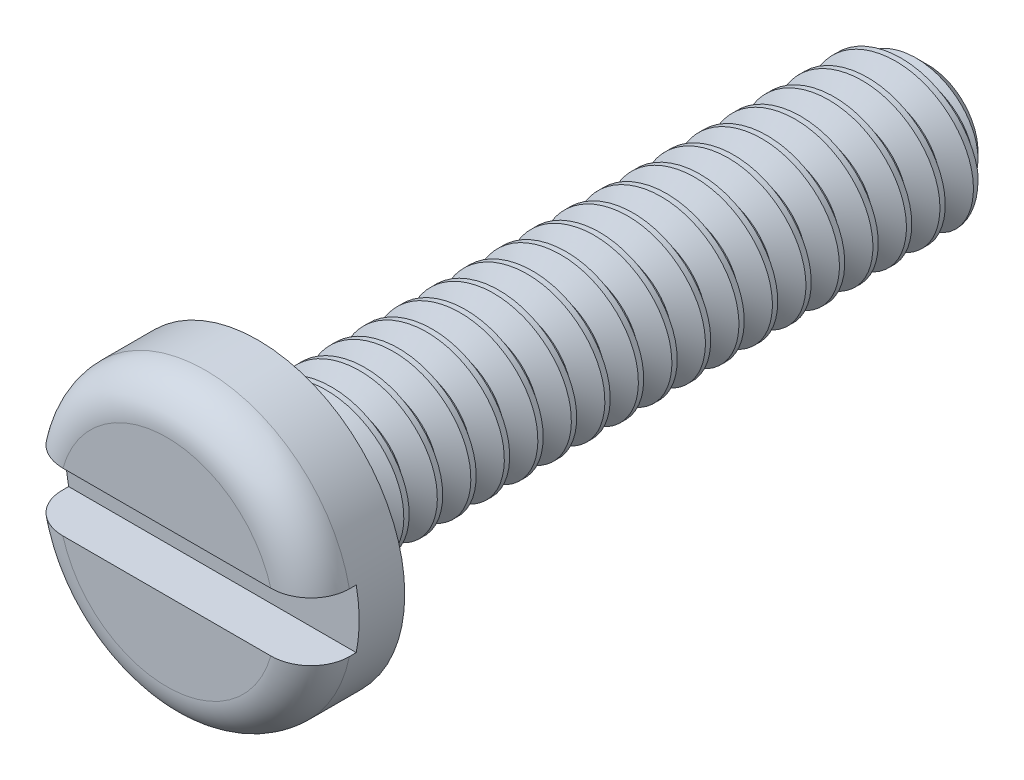
from build123d import *

# Parameters (mm, degrees)
SKETCH1_R        = 2.7813
EXTRUDE3_DEPTH   = 1.7272
SKETCH4_W        = 12.7
SKETCH4_H        = 1.4224
CHAMFER2_SIZE    = 0.47625
CUT_SWEEP1_PITCH = 0.635
CUT_SWEEP1_TO    = 12.7
SKETCH26_R       = 0.5461
EXTRUDE13_DEPTH  = 1.7272
SKETCH31_W       = 5.5626
SKETCH31_H       = 1.11125
EXTRUDE15_DEPTH  = 0.8636


with BuildPart() as part:
    # Sketch1 → Extrude3 (new body)
    with BuildSketch(Plane.XY):
        Circle(SKETCH1_R)
    extrude(amount=EXTRUDE3_DEPTH)

    # Sketch11 → Cut-Revolve3 (revolve, cut)
    with BuildSketch(Plane(origin=(0, 0, 0), x_dir=(0, 0, -1), z_dir=(1, 0, 0))):
        with BuildLine():
            Line((-1.7272, 2.04724), (-1.7272, 0))
            Line((-1.7272, 0), (-1.9812, 0))
            Line((-1.9812, 0), (-1.9812, 2.892552))
            Line((-1.9812, 2.892552), (0, 2.892552))
            Line((0, 2.892552), (0, 2.7813))
            Line((0, 2.7813), (-0.99314, 2.7813))
            ThreePointArc((-0.99314, 2.7813), (-1.512198804, 2.566298804), (-1.7272, 2.04724))
        make_face()
    revolve(axis=Axis((0, 0, 0), (0, 0, 1)), mode=Mode.SUBTRACT)



with BuildPart() as body_2:
    # Sketch4 → Revolve1 (revolve)
    with BuildSketch(Plane(origin=(0, 0, 0), x_dir=(0, 0, -1), z_dir=(1, 0, 0))):
        with Locations((6.35, 0.7112)):
            Rectangle(SKETCH4_W, SKETCH4_H)
    revolve(axis=Axis((0, 0, 0), (0, 0, -1)))

    # Chamfer2
    chamfer2_edges = [body_2.edges().sort_by_distance(p)[0] for p in [
        (0, -1.4224, -12.7),
    ]]
    chamfer(chamfer2_edges, length=CHAMFER2_SIZE)

    # Cut-Sweep1: arcs per turn and ends read off the stored shape
    # Cut-Sweep1: the profile of Sketch14 screwed along a right-hand helix through 22.72 turns, 6 arcs to a turn; built about Z, then put on its axis
    cut_sweep1_z = Axis((0, 0, 0), (0, 0, 1))
    cut_sweep1_corners = [(1.44224375, 2.52e-07, -0.158749982), (1.44224375, 2.52e-07, -0.714374982), (1.012654878, 1.77e-07, -0.476249982), (1.012654878, 1.77e-07, -0.396874982)]
    with BuildLine(mode=Mode.PRIVATE) as cut_sweep1_profile:
        Line(cut_sweep1_corners[0], cut_sweep1_corners[1])
        Line(cut_sweep1_corners[1], cut_sweep1_corners[2])
        Line(cut_sweep1_corners[2], cut_sweep1_corners[3])
        Line(cut_sweep1_corners[3], cut_sweep1_corners[0])
    cut_sweep1_cap = Face(cut_sweep1_profile.wire())
    cut_sweep1_turn_angles = [0, 30, 60, 90, 120, 150, 180, 210, 240, 270, 300, 330, 360]
    cut_sweep1_turn_weights = [1, 0.8660254037844387, 1, 0.8660254037844387, 1, 0.8660254037844387, 1, 0.8660254037844387, 1, 0.8660254037844387, 1, 0.8660254037844387, 1]
    cut_sweep1_turn_rails = [Edge.make_bspline([Vector(p[0], p[1], 0).rotate(cut_sweep1_z, cut_sweep1_turn_angles[k]) / cut_sweep1_turn_weights[k] + Vector(0, 0, p[2] + CUT_SWEEP1_PITCH * cut_sweep1_turn_angles[k] / 360) for k in range(13)], [0, 0, 0, 1, 1, 2, 2, 3, 3, 4, 4, 5, 5, 6, 6, 6], 2, cut_sweep1_turn_weights) for p in cut_sweep1_corners]
    cut_sweep1_turn_sides = [Face.make_surface_from_curves(cut_sweep1_turn_rails[p[0]], cut_sweep1_turn_rails[p[1]]) for p in [(0, 1), (1, 2), (2, 3), (3, 0)]]
    cut_sweep1_last_angles = [7920, 7950, 7980, 8010, 8040, 8070, 8100, 8130, 8160, 8169.6, 8179.2]
    cut_sweep1_last_weights = [1, 0.8660254037844387, 1, 0.8660254037844387, 1, 0.8660254037844387, 1, 0.8660254037844387, 1, 0.9859960370704985, 1]
    cut_sweep1_last_rails = [Edge.make_bspline([Vector(p[0], p[1], 0).rotate(cut_sweep1_z, cut_sweep1_last_angles[k]) / cut_sweep1_last_weights[k] + Vector(0, 0, p[2] + CUT_SWEEP1_PITCH * cut_sweep1_last_angles[k] / 360) for k in range(11)], [0, 0, 0, 1, 1, 2, 2, 3, 3, 4, 4, 5, 5, 5], 2, cut_sweep1_last_weights) for p in cut_sweep1_corners]
    cut_sweep1_last_sides = [Face.make_surface_from_curves(cut_sweep1_last_rails[p[0]], cut_sweep1_last_rails[p[1]]) for p in [(0, 1), (1, 2), (2, 3), (3, 0)]]
    cut_sweep1 = Plane(origin=(0, 0, -12.7), x_dir=(1, 0, 0), z_dir=(0, 0, 1)) * split(Solid(Shell([*[p.moved(Location((0, 0, CUT_SWEEP1_PITCH * i))) for i in range(22) for p in cut_sweep1_turn_sides], *cut_sweep1_last_sides, cut_sweep1_cap, cut_sweep1_cap.rotate(cut_sweep1_z, 8179.2).moved(Location((0, 0, CUT_SWEEP1_PITCH * 8179.2 / 360)))])), bisect_by=Plane.XY.offset(CUT_SWEEP1_TO), keep=Keep.BOTTOM, mode=Mode.PRIVATE)
    add(cut_sweep1, mode=Mode.SUBTRACT)


with BuildPart() as part_1:
    add(part.part)

    add(body_2.part)  # Extrude13 merges body 2
    # Sketch26 → Extrude13 (add)
    with BuildSketch(Plane.XY):
        Circle(SKETCH26_R)
    extrude(amount=EXTRUDE13_DEPTH)

    # Sketch31 → Extrude15 (cut)
    with BuildSketch(Plane.XY.offset(1.7272)):
        Rectangle(SKETCH31_W, SKETCH31_H)
    extrude(amount=-EXTRUDE15_DEPTH, mode=Mode.SUBTRACT)


solid = part_1.part
